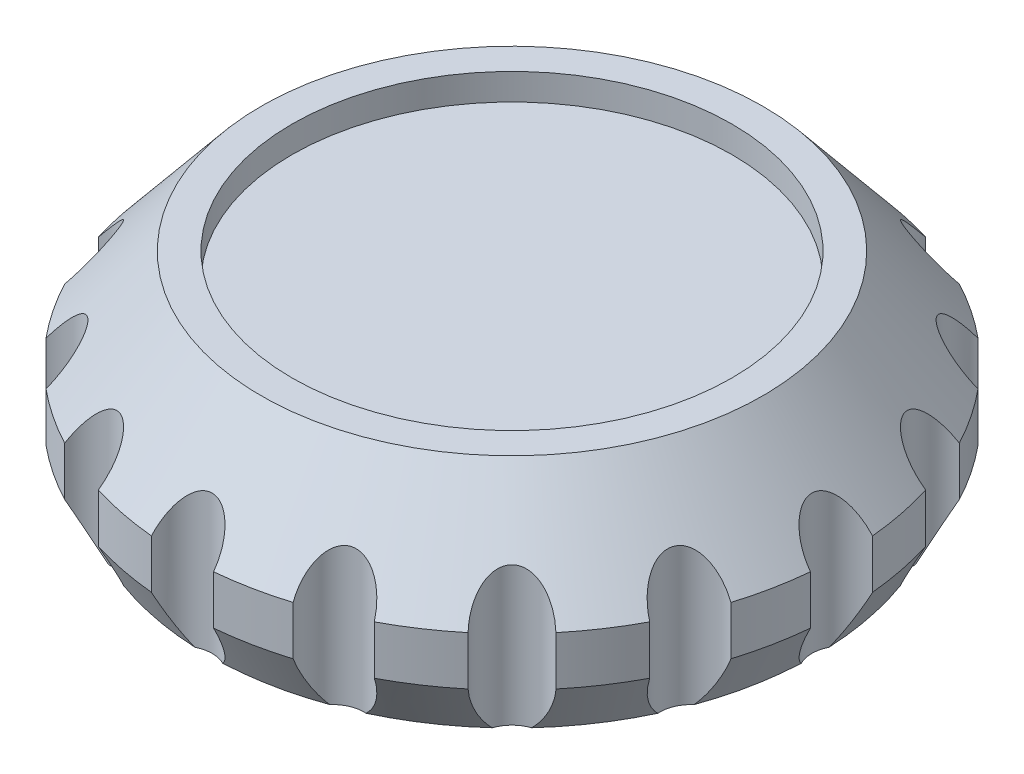
from build123d import *

# Parameters (mm, degrees)
SKETCH1_R           = 63.5
BOSS_EXTRUDE1_DEPTH = 38.1
SKETCH7_R           = 1.984375
CUT_EXTRUDE4_DEPTH  = 2.54
SKETCH5_R           = 5.967162319
CUT_EXTRUDE2_DEPTH  = 98.550550998
SKETCH6_R           = 42.200087512
CUT_EXTRUDE3_DEPTH  = 5.08


with BuildPart() as part:
    # Sketch1 → Boss-Extrude1 (new body)
    with BuildSketch(Plane(origin=(0, 0, 0), x_dir=(1, 0, 0), z_dir=(0, 1, 0))):
        Circle(SKETCH1_R)
    extrude(amount=BOSS_EXTRUDE1_DEPTH)

    # Sketch7 → Cut-Extrude4 (cut)
    with BuildSketch(Plane.XZ):
        with Locations((0, 46.032792877)):
            Circle(SKETCH7_R)
        with Locations((46.032792877, 0)):
            Circle(SKETCH7_R)
        with Locations((0, -46.032792877)):
            Circle(SKETCH7_R)
        with Locations((-46.032792877, 0)):
            Circle(SKETCH7_R)
    extrude(amount=-CUT_EXTRUDE4_DEPTH, mode=Mode.SUBTRACT)

    # Sketch3 → Cut-Revolve1 (revolve, cut)
    with BuildSketch(Plane(origin=(0, 0, 0), x_dir=(0, 0, -1), z_dir=(1, 0, 0))):
        Polygon((58.21304378, 0), (63.5, 10.025991679), (63.5, 0), align=None)
        Polygon((63.5, 19.394528), (48.123850498, 38.1), (63.5, 38.1), align=None)
    revolve(axis=Axis((0, 0, 0), (0, 1, 0)), mode=Mode.SUBTRACT)

    # Sketch5 → Cut-Extrude2 (cut, through all)
    with BuildSketch(Plane(origin=(0, 0, 0), x_dir=(1, 0, 0), z_dir=(0, 1, 0))):
        with Locations((0, 63.5)):
            Circle(SKETCH5_R)
        with Locations((24.300397955, 58.666350314)):
            Circle(SKETCH5_R)
        with Locations((44.901280605, 44.901280605)):
            Circle(SKETCH5_R)
        with Locations((58.666350314, 24.300397955)):
            Circle(SKETCH5_R)
        with Locations((63.5, 0)):
            Circle(SKETCH5_R)
        with Locations((58.666350314, -24.300397955)):
            Circle(SKETCH5_R)
        with Locations((44.901280605, -44.901280605)):
            Circle(SKETCH5_R)
        with Locations((24.300397955, -58.666350314)):
            Circle(SKETCH5_R)
        with Locations((0, -63.5)):
            Circle(SKETCH5_R)
        with Locations((-24.300397955, -58.666350314)):
            Circle(SKETCH5_R)
        with Locations((-44.901280605, -44.901280605)):
            Circle(SKETCH5_R)
        with Locations((-58.666350314, -24.300397955)):
            Circle(SKETCH5_R)
        with Locations((-63.5, 0)):
            Circle(SKETCH5_R)
        with Locations((-58.666350314, 24.300397955)):
            Circle(SKETCH5_R)
        with Locations((-44.901280605, 44.901280605)):
            Circle(SKETCH5_R)
        with Locations((-24.300397955, 58.666350314)):
            Circle(SKETCH5_R)
    extrude(amount=CUT_EXTRUDE2_DEPTH, mode=Mode.SUBTRACT)

    # Sketch6 → Cut-Extrude3 (cut)
    with BuildSketch(Plane(origin=(0, 38.1, 0), x_dir=(1, 0, 0), z_dir=(0, 1, 0))):
        Circle(SKETCH6_R)
    extrude(amount=-CUT_EXTRUDE3_DEPTH, mode=Mode.SUBTRACT)


solid = part.part
